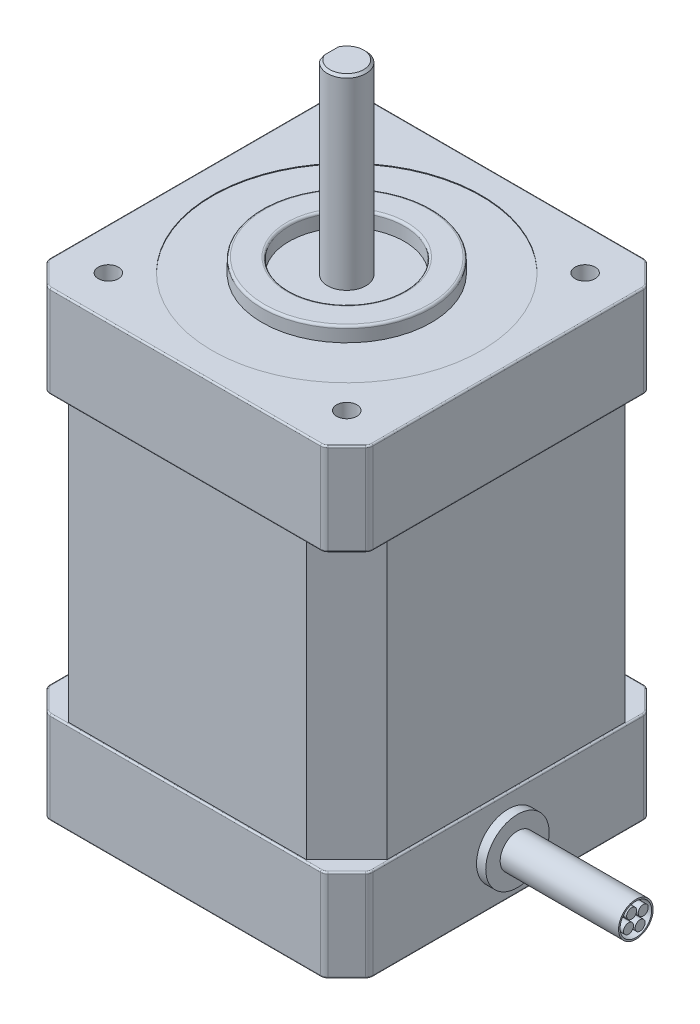
from build123d import *

# Parameters (mm, degrees)
SKETCH_1_W               = 42
SKETCH_1_H               = 42
EXTRUDE_1_DEPTH          = 60
CHAMFER_3_SIZE           = 3
SKETCH_2_R               = 11
EXTRUDE_2_DEPTH          = 1.8
SKETCH_3_R               = 2.5
EXTRUDE_3_DEPTH          = 24
SKETCH_4_OUTSIDE_W       = 64.576
SKETCH_4_OUTSIDE_H       = 64.576
CUT_EXTRUDE_1_DEPTH      = 36
FILLET_2_R               = 1
FILLET_3_R               = 0.2
CUT_EXTRUDE_START        = -15
CUT_EXTRUDE_5_DEPTH      = 15
CHAMFER_5_SIZE           = 0.3
CHAMFER_4_SIZE           = 0.5
SKETCH_6_R               = 1.3105
CUT_EXTRUDE_2_DEPTH      = 4.5
CUT_EXTRUDE_START_2      = -2
SKETCH_7_R               = 7.5
SKETCH_7_R_2             = 2.5
CUT_EXTRUDE_3_DEPTH      = 2
SKETCH_8_R               = 4.125
EXTRUDE_5_DEPTH          = 1.2
SKETCH_9_R               = 2.25
SKETCH_9_R_2             = 2.05
EXTRUDE_6_DEPTH          = 15.4
SKETCH_10_R              = 0.65
EXTRUDE_8_DEPTH          = 15.4
CUT_EXTRUDE_START_3      = -0.1
SKETCH_15_R              = 17.5
SKETCH_15_R_2            = 11
CUT_EXTRUDE_6_DEPTH      = 0.1
FILLET_4_R               = 0.3
PATTERN_CIRCULAR_3_COUNT = 4


with BuildPart() as part:
    # 草图1 → 凸台-拉伸1 (new body)
    with BuildSketch(Plane(origin=(0, 0, 0), x_dir=(1, 0, 0), z_dir=(0, 1, 0))):
        Rectangle(SKETCH_1_W, SKETCH_1_H)
    extrude(amount=EXTRUDE_1_DEPTH)

    # 倒角3
    chamfer_3_edges = [part.edges().sort_by_distance(p)[0] for p in [
        (-21, 30, -21),
        (21, 30, -21),
        (21, 30, 21),
        (-21, 30, 21),
    ]]
    chamfer(chamfer_3_edges, length=CHAMFER_3_SIZE)

    # 草图2 → 凸台-拉伸2 (add)
    with BuildSketch(Plane(origin=(0, 60, 0), x_dir=(1, 0, 0), z_dir=(0, 1, 0))):
        with Locations(Location((0, 0, 0), (0, 0, 270))):
            Circle(SKETCH_2_R)
    extrude(amount=EXTRUDE_2_DEPTH)

    # 草图3 → 凸台-拉伸3 (add)
    with BuildSketch(Plane(origin=(0, 60, 0), x_dir=(1, 0, 0), z_dir=(0, 1, 0))):
        with Locations(Location((0, 0, 0), (0, 0, 270))):
            Circle(SKETCH_3_R)
    extrude(amount=EXTRUDE_3_DEPTH)

    # 草图4 outside → 切除-拉伸1 (cut)
    with BuildSketch(Plane.XZ.offset(-12)):
        Rectangle(SKETCH_4_OUTSIDE_W, SKETCH_4_OUTSIDE_H)
        Polygon((15.471572875, 20.7), (-15.471572875, 20.7), (-20.7, 15.471572875), (-20.7, -15.471572875), (-15.471572875, -20.7), (15.471572875, -20.7), (20.7, -15.471572875), (20.7, 15.471572875), align=None, mode=Mode.SUBTRACT)
    extrude(amount=-CUT_EXTRUDE_1_DEPTH, mode=Mode.SUBTRACT)

    # 圆角2
    fillet_2_edges = [part.edges().sort_by_distance(p)[0] for p in [
        (-18, 6, -21),
        (18, 54, -21),
        (21, 54, 18),
        (21, 6, -18),
        (-18, 54, 21),
        (18, 6, 21),
        (-21, 54, -18),
        (-21, 6, 18),
        (-18, 54, -21),
        (-21, 6, -18),
        (-21, 54, 18),
        (-18, 6, 21),
        (18, 54, 21),
        (21, 6, 18),
        (21, 54, -18),
        (18, 6, -21),
    ]]
    fillet(fillet_2_edges, radius=FILLET_2_R)

    # 圆角3
    fillet_3_edges = [part.edges().sort_by_distance(p)[0] for p in [
        (21, 12, 0),
        (21, 0, 0),
        (0, 0, -21),
        (19.5, 0, -19.5),
        (19.5, 0, 19.5),
        (0, 0, 21),
        (-19.5, 0, 19.5),
        (-21, 0, 0),
        (-19.5, 0, -19.5),
        (-20.923879533, 0, -17.96846987),
        (-17.96846987, 0, -20.923879533),
        (17.96846987, 0, -20.923879533),
        (20.923879533, 0, -17.96846987),
        (-20.923879533, 0, 17.96846987),
        (-17.96846987, 0, 20.923879533),
        (17.96846987, 0, 20.923879533),
        (20.923879533, 0, 17.96846987),
        (19.5, 12, 19.5),
        (19.5, 12, -19.5),
        (0, 12, -21),
        (-19.5, 12, -19.5),
        (-21, 12, 0),
        (-19.5, 12, 19.5),
        (0, 12, 21),
        (-20.923879533, 12, -17.96846987),
        (-17.96846987, 12, -20.923879533),
        (17.96846987, 12, -20.923879533),
        (20.923879533, 12, -17.96846987),
        (-20.923879533, 12, 17.96846987),
        (-17.96846987, 12, 20.923879533),
        (17.96846987, 12, 20.923879533),
        (20.923879533, 12, 17.96846987),
        (0, 48, -21),
        (0, 60, -21),
        (21, 60, 0),
        (19.5, 60, -19.5),
        (-19.5, 60, -19.5),
        (-21, 60, 0),
        (-19.5, 60, 19.5),
        (0, 60, 21),
        (19.5, 60, 19.5),
        (-20.923879533, 60, 17.96846987),
        (-17.96846987, 60, 20.923879533),
        (17.96846987, 60, 20.923879533),
        (20.923879533, 60, 17.96846987),
        (17.96846987, 60, -20.923879533),
        (20.923879533, 60, -17.96846987),
        (-20.923879533, 60, -17.96846987),
        (-17.96846987, 60, -20.923879533),
        (-19.5, 48, -19.5),
        (0, 48, 21),
        (-19.5, 48, 19.5),
        (-21, 48, 0),
        (19.5, 48, -19.5),
        (21, 48, 0),
        (19.5, 48, 19.5),
        (-20.923879533, 48, 17.96846987),
        (-17.96846987, 48, 20.923879533),
        (17.96846987, 48, 20.923879533),
        (20.923879533, 48, 17.96846987),
        (17.96846987, 48, -20.923879533),
        (20.923879533, 48, -17.96846987),
        (-20.923879533, 48, -17.96846987),
        (-17.96846987, 48, -20.923879533),
    ]]
    fillet(fillet_3_edges, radius=FILLET_3_R)

    # 草图14 → 切除-拉伸5 (cut)
    with BuildSketch(Plane(origin=(0, 84, 0), x_dir=(1, 0, 0), z_dir=(0, 1, 0)).offset(CUT_EXTRUDE_START)):
        with BuildLine():
            Line((-2, 1.5), (-2, -1.5))
            ThreePointArc((-2, -1.5), (-2.5, 0), (-2, 1.5))
        make_face()
    extrude(amount=CUT_EXTRUDE_5_DEPTH, mode=Mode.SUBTRACT)

    # 倒角5
    chamfer_5_edges = [part.edges().sort_by_distance(p)[0] for p in [
        (2.236067977, 84, -1.118033989),
    ]]
    chamfer(chamfer_5_edges, length=CHAMFER_5_SIZE)

    # 倒角4
    chamfer_4_edges = [part.edges().sort_by_distance(p)[0] for p in [
        (-2, 69, 0),
    ]]
    chamfer(chamfer_4_edges, length=CHAMFER_4_SIZE - 0.0001)  # a hair under: the kernel refuses the full size

    # 草图6 → 切除-拉伸2 (cut)
    with BuildSketch(Plane(origin=(0, 60, 0), x_dir=(1, 0, 0), z_dir=(0, 1, 0))):
        with Locations(Location((-15.5, 15.5, 0), (0, 0, 270))):
            Circle(SKETCH_6_R)
        with Locations(Location((15.5, 15.5, 0), (0, 0, 90))):
            Circle(SKETCH_6_R)
        with Locations(Location((15.5, -15.5, 0), (0, 0, 270))):
            Circle(SKETCH_6_R)
        with Locations(Location((-15.5, -15.5, 0), (0, 0, 90))):
            Circle(SKETCH_6_R)
    extrude(amount=-CUT_EXTRUDE_2_DEPTH, mode=Mode.SUBTRACT)

    # 草图7 → 切除-拉伸3 (cut)
    with BuildSketch(Plane(origin=(0, 61.8, 0), x_dir=(1, 0, 0), z_dir=(0, 1, 0)).offset(CUT_EXTRUDE_START_2)):
        with Locations(Location((0, 0, 0), (0, 0, 270))):
            Circle(SKETCH_7_R)
        with Locations(Location((0, 0, 0), (0, 0, 143.130102354))):
            Circle(SKETCH_7_R_2, mode=Mode.SUBTRACT)
    extrude(amount=CUT_EXTRUDE_3_DEPTH, mode=Mode.SUBTRACT)

    # 草图8 → 凸台-拉伸5 (add)
    with BuildSketch(Plane(origin=(21, 0, 0), x_dir=(0, 0, -1), z_dir=(1, 0, 0))):
        with Locations(Location((0, 6, 0), (0, 0, 180))):
            Circle(SKETCH_8_R)
    extrude(amount=EXTRUDE_5_DEPTH)

    # 草图9 → 凸台-拉伸6 (add)
    with BuildSketch(Plane(origin=(22.2, 0, 0), x_dir=(0, 0, -1), z_dir=(1, 0, 0))):
        with Locations(Location((0, 6, 0), (0, 0, 180))):
            Circle(SKETCH_9_R)
        with Locations(Location((0, 6, 0), (0, 0, 180))):
            Circle(SKETCH_9_R_2, mode=Mode.SUBTRACT)
    extrude(amount=EXTRUDE_6_DEPTH)

    # 草图10 → 凸台-拉伸8 (add)
    with BuildSketch(Plane(origin=(22.2, 0, 0), x_dir=(0, 0, -1), z_dir=(1, 0, 0))):
        with Locations((0.952627944, 6.55)):
            Circle(SKETCH_10_R)
    extrude_8 = extrude(amount=EXTRUDE_8_DEPTH)

    # 草图15 → 切除-拉伸6 (cut)
    with BuildSketch(Plane(origin=(0, 60, 0), x_dir=(1, 0, 0), z_dir=(0, 1, 0)).offset(CUT_EXTRUDE_START_3)):
        with Locations(Location((0, 0, 0), (0, 0, 270))):
            Circle(SKETCH_15_R)
        with Locations(Location((0, 0, 0), (0, 0, 270))):
            Circle(SKETCH_15_R_2, mode=Mode.SUBTRACT)
    extrude(amount=CUT_EXTRUDE_6_DEPTH, mode=Mode.SUBTRACT)

    # 圆角4
    fillet_4_edges = [part.edges().sort_by_distance(p)[0] for p in [
        (0, 61.8, -11),
        (0, 61.8, -7.5),
    ]]
    fillet(fillet_4_edges, radius=FILLET_4_R)

    # 阵列(圆周)3: 凸台-拉伸8 ×4 about axis
    pattern_circular_3_axis = Axis((0, 6, 0), (1, 0, 0))
    for i in range(1, PATTERN_CIRCULAR_3_COUNT):
        add(extrude_8.rotate(pattern_circular_3_axis, i * 360 / PATTERN_CIRCULAR_3_COUNT))


solid = part.part
